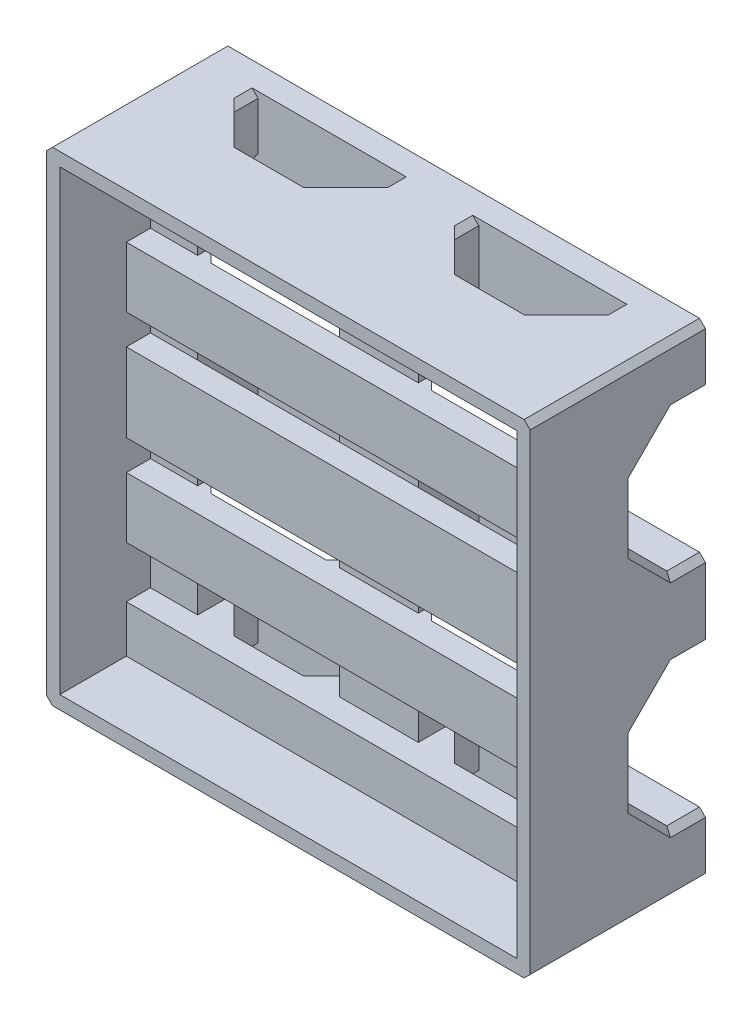
from build123d import *

# Parameters (mm, degrees)
CROQUIS1_W                = 13
CROQUIS1_H                = 80
SALIENTE_EXTRUIR1_DEPTH   = 4
CROQUIS1_W_2              = 10
SALIENTE_EXTRUIR1_2_DEPTH = 4
SALIENTE_EXTRUIR1_3_DEPTH = 4
CROQUIS2_W                = 13
CROQUIS2_H                = 13
CROQUIS2_W_2              = 10
CROQUIS2_H_2              = 10
SALIENTE_EXTRUIR2_DEPTH   = 10
CROQUIS3_W                = 13
CROQUIS3_H                = 80
CROQUIS3_W_2              = 10
SALIENTE_EXTRUIR3_DEPTH   = 2.2
CROQUIS4_W                = 80
CROQUIS4_H                = 10
CROQUIS4_H_2              = 13
SALIENTE_EXTRUIR4_DEPTH   = 4
CROQUIS5_W                = 80
CROQUIS5_H                = 80
CROQUIS5_W_2              = 75.6
CROQUIS5_H_2              = 75.6
SALIENTE_EXTRUIR5_DEPTH   = 15
CHAFL_N2_SIZE             = 6.4
CHAFL_N3_SIZE             = 6
CHAFL_N4_SIZE             = 2.2
CORTAR_EXTRUIR1_DEPTH     = 0.4
REDONDEO1_R               = 1
CHAFL_N1_SIZE             = 1


with BuildPart() as part:
    # Croquis1 → Saliente-Extruir1 (new body)
    with BuildSketch(Plane(origin=(0, 0, 0), x_dir=(0, 1, 0), z_dir=(0, 0, 1))):
        Rectangle(CROQUIS1_W, CROQUIS1_H)
    extrude(amount=SALIENTE_EXTRUIR1_DEPTH)



with BuildPart() as body_2:
    # Croquis1 → Saliente-Extruir1 2 (new body)
    with BuildSketch(Plane(origin=(0, 0, 0), x_dir=(0, 1, 0), z_dir=(0, 0, 1))):
        with Locations((35, 0)):
            Rectangle(CROQUIS1_W_2, CROQUIS1_H)
    extrude(amount=SALIENTE_EXTRUIR1_2_DEPTH)


with BuildPart() as body_3:
    # Croquis1 → Saliente-Extruir1 3 (new body)
    with BuildSketch(Plane(origin=(0, 0, 0), x_dir=(0, 1, 0), z_dir=(0, 0, 1))):
        with Locations((-35, 0)):
            Rectangle(CROQUIS1_W_2, CROQUIS1_H)
    extrude(amount=SALIENTE_EXTRUIR1_3_DEPTH)


with BuildPart() as part_1:
    add(part.part)

    add(body_2.part)  # Saliente-Extruir2 merges body 2

    add(body_3.part)  # Saliente-Extruir2 merges body 3
    # Croquis2 → Saliente-Extruir2 (add)
    with BuildSketch(Plane.XY.offset(4)):
        Rectangle(CROQUIS2_W, CROQUIS2_H)
        with Locations((-35, 0)):
            Rectangle(CROQUIS2_W_2, CROQUIS2_H)
        with Locations((35, 0)):
            Rectangle(CROQUIS2_W_2, CROQUIS2_H)
        with Locations((0, 35)):
            Rectangle(CROQUIS2_W, CROQUIS2_H_2)
        with Locations((-35, 35)):
            Rectangle(CROQUIS2_W_2, CROQUIS2_H_2)
        with Locations((35, 35)):
            Rectangle(CROQUIS2_W_2, CROQUIS2_H_2)
        with Locations((35, -35)):
            Rectangle(CROQUIS2_W_2, CROQUIS2_H_2)
        with Locations((-35, -35)):
            Rectangle(CROQUIS2_W_2, CROQUIS2_H_2)
        with Locations((0, -35)):
            Rectangle(CROQUIS2_W, CROQUIS2_H_2)
    extrude(amount=SALIENTE_EXTRUIR2_DEPTH)

    # Croquis3 → Saliente-Extruir3 (add)
    with BuildSketch(Plane.XY.offset(14)):
        Rectangle(CROQUIS3_W, CROQUIS3_H)
        with Locations((-35, 0)):
            Rectangle(CROQUIS3_W_2, CROQUIS3_H)
        with Locations((35, 0)):
            Rectangle(CROQUIS3_W_2, CROQUIS3_H)
    extrude(amount=-SALIENTE_EXTRUIR3_DEPTH)

    # Croquis4 → Saliente-Extruir4 (add)
    with BuildSketch(Plane.XY.offset(14)):
        with Locations((0, -35)):
            Rectangle(CROQUIS4_W, CROQUIS4_H)
        Rectangle(CROQUIS4_W, CROQUIS4_H_2)
        with Locations((0, 35)):
            Rectangle(CROQUIS4_W, CROQUIS4_H)
        with Locations((0, 16.5)):
            Rectangle(CROQUIS4_W, CROQUIS4_H)
        with Locations((0, -16.5)):
            Rectangle(CROQUIS4_W, CROQUIS4_H)
    extrude(amount=SALIENTE_EXTRUIR4_DEPTH)

    # Croquis5 → Saliente-Extruir5 (add)
    with BuildSketch(Plane.XY.offset(14)):
        Rectangle(CROQUIS5_W, CROQUIS5_H)
        Rectangle(CROQUIS5_W_2, CROQUIS5_H_2, mode=Mode.SUBTRACT)
    extrude(amount=SALIENTE_EXTRUIR5_DEPTH)

    # Chaflán2
    chafl_n2_edges = [part_1.edges().sort_by_distance(p)[0] for p in [
        (0, -30, 11.8),
        (-35, 6.5, 11.8),
        (-35, -6.5, 11.8),
        (-35, 30, 11.8),
        (-35, -30, 11.8),
        (35, 6.5, 11.8),
        (35, 30, 11.8),
        (35, -6.5, 11.8),
        (35, -30, 11.8),
        (0, 6.5, 11.8),
        (0, -6.5, 11.8),
        (0, 30, 11.8),
    ]]
    chamfer(chafl_n2_edges, length=CHAFL_N2_SIZE)

    # Chaflán3
    chafl_n3_edges = [part_1.edges().sort_by_distance(p)[0] for p in [
        (-6.5, -35, 14),
        (30, -35, 14),
        (6.5, 35, 14),
        (-30, 35, 14),
        (6.5, -35, 14),
        (-6.5, 35, 14),
        (-30, -35, 14),
        (30, 35, 14),
    ]]
    chamfer(chafl_n3_edges, length=CHAFL_N3_SIZE)

    # Chaflán4
    chafl_n4_edges = [part_1.edges().sort_by_distance(p)[0] for p in [
        (30, 16.5, 14),
        (30, -16.5, 14),
        (6.5, -16.5, 14),
        (-6.5, -16.5, 14),
        (-30, -16.5, 14),
        (6.5, 16.5, 14),
        (-30, 16.5, 14),
    ]]
    chamfer(chafl_n4_edges, length=CHAFL_N4_SIZE - 0.0001)  # a hair under: the kernel refuses the full size

    # Croquis6 → Cortar-Extruir1 (cut)
    with BuildSketch(Plane(origin=(-40, 0, 0), x_dir=(0, -1, 0), z_dir=(-1, 0, 0))):
        Polygon((-5, 9.5), (5, 9.5), (3, 19.5), (-3, 19.5), align=None)
    extrude(amount=-CORTAR_EXTRUIR1_DEPTH, mode=Mode.SUBTRACT)

    # Redondeo1
    redondeo1_edges = [part_1.edges().sort_by_distance(p)[0] for p in [
        (-39.8, -3, 19.5),
        (-39.8, -5, 9.5),
        (-39.8, 5, 9.5),
        (-39.8, 3, 19.5),
    ]]
    fillet(redondeo1_edges, radius=REDONDEO1_R)

    # Chaflán1
    chafl_n1_edges = [part_1.edges().sort_by_distance(p)[0] for p in [
        (-40, 40, 14.5),
        (-40, -40, 14.5),
        (40, -40, 14.5),
        (40, 6.5, 2.7),
        (-40, 6.5, 2.7),
        (-30, 6.5, 4.7),
        (-6.5, 6.5, 4.7),
        (6.5, 6.5, 4.7),
        (30, 6.5, 4.7),
        (6.5, -6.5, 4.7),
        (-30, -6.5, 4.7),
        (-40, -6.5, 2.7),
        (40, -6.5, 2.7),
        (-40, -18.25, 11.8),
        (30, 30, 4.7),
        (-6.5, 30, 4.7),
        (-30, 30, 4.7),
        (-40, 30, 2.7),
        (40, 30, 2.7),
        (-40, 18.25, 11.8),
        (40, -30, 2.7),
        (-40, -30, 2.7),
        (-30, -30, 4.7),
        (6.5, -30, 4.7),
        (30, -30, 4.7),
        (40, 18.25, 11.8),
        (40, -18.25, 11.8),
        (-40, -9.7, 8.6),
        (-40, 26.8, 8.6),
        (-40, 9.7, 8.6),
        (-40, -26.8, 8.6),
        (40, 9.7, 8.6),
        (40, 26.8, 8.6),
        (40, -9.7, 8.6),
        (40, -26.8, 8.6),
        (30, 40, 6),
        (30, -40, 6),
        (-30, 40, 6),
        (-30, -40, 6),
        (6.5, 40, 6),
        (-6.5, -40, 6),
        (6.5, -40, 6),
        (-6.5, 40, 6),
        (40, 40, 14.5),
    ]]
    chamfer(chafl_n1_edges, length=CHAFL_N1_SIZE)


solid = part_1.part
